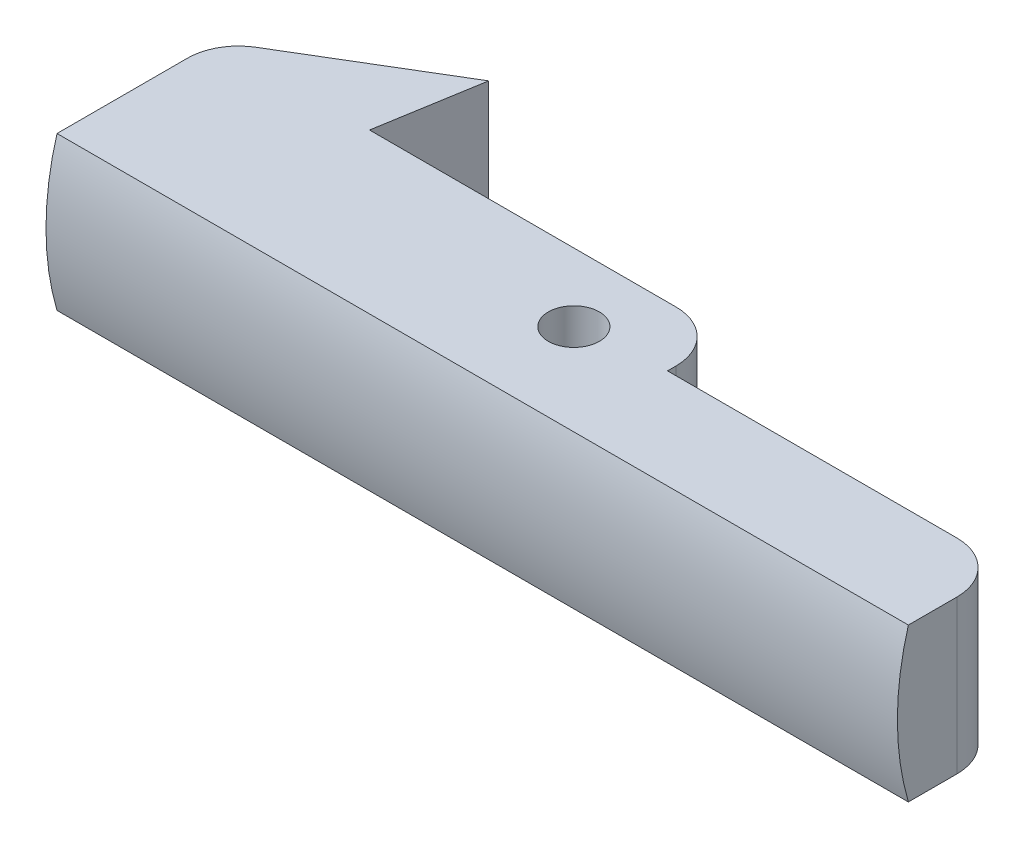
from build123d import *

# Parameters (mm, degrees)
CROQUIS1_R              = 1.5
SALIENTE_EXTRUIR1_DEPTH = 9
CROQUIS2_W              = 20
CROQUIS2_H              = 3.5
CORTAR_EXTRUIR1_DEPTH   = 18
REDONDEO1_R             = 3
CORTAR_EXTRUIR2_DEPTH   = 51


with BuildPart() as part:
    # Croquis1 → Saliente-Extruir1 (new body)
    with BuildSketch(Plane(origin=(0, 0, 0), x_dir=(1, 0, 0), z_dir=(0, 1, 0))):
        Polygon((0, 0), (0, 10), (10, 16), (9, 10), (50, 10), (50, 0), align=None)
        with Locations((25, 6)):
            Circle(CROQUIS1_R, mode=Mode.SUBTRACT)
    extrude(amount=SALIENTE_EXTRUIR1_DEPTH)

    # Croquis2 → Cortar-Extruir1 (cut)
    with BuildSketch(Plane(origin=(0, 9, 0), x_dir=(1, 0, 0), z_dir=(0, 1, 0))):
        with Locations((40, 8.25)):
            Rectangle(CROQUIS2_W, CROQUIS2_H)
    extrude(amount=-CORTAR_EXTRUIR1_DEPTH, mode=Mode.SUBTRACT)

    # Redondeo1
    redondeo1_edges = [part.edges().sort_by_distance(p)[0] for p in [
        (0, 4.5, -10),
        (50, 4.5, -6.5),
        (30, 4.5, -10),
    ]]
    fillet(redondeo1_edges, radius=REDONDEO1_R)

    # Croquis4 → Cortar-Extruir2 (cut)
    with BuildSketch(Plane.ZY):
        with BuildLine():
            Line((-0.645847467, 0), (0, 0))
            Line((0, 0), (0, 4.500000055))
            ThreePointArc((0, 4.500000055), (-0.162284875, 2.226944872), (-0.645847467, 0))
        make_face()
        with BuildLine():
            ThreePointArc((-0.645847467, 9), (-0.162284883, 6.773055182), (0, 4.500000055))
            Line((0, 4.500000055), (0, 9))
            Line((0, 9), (-0.645847467, 9))
        make_face()
    extrude(amount=-CORTAR_EXTRUIR2_DEPTH, mode=Mode.SUBTRACT)


solid = part.part
